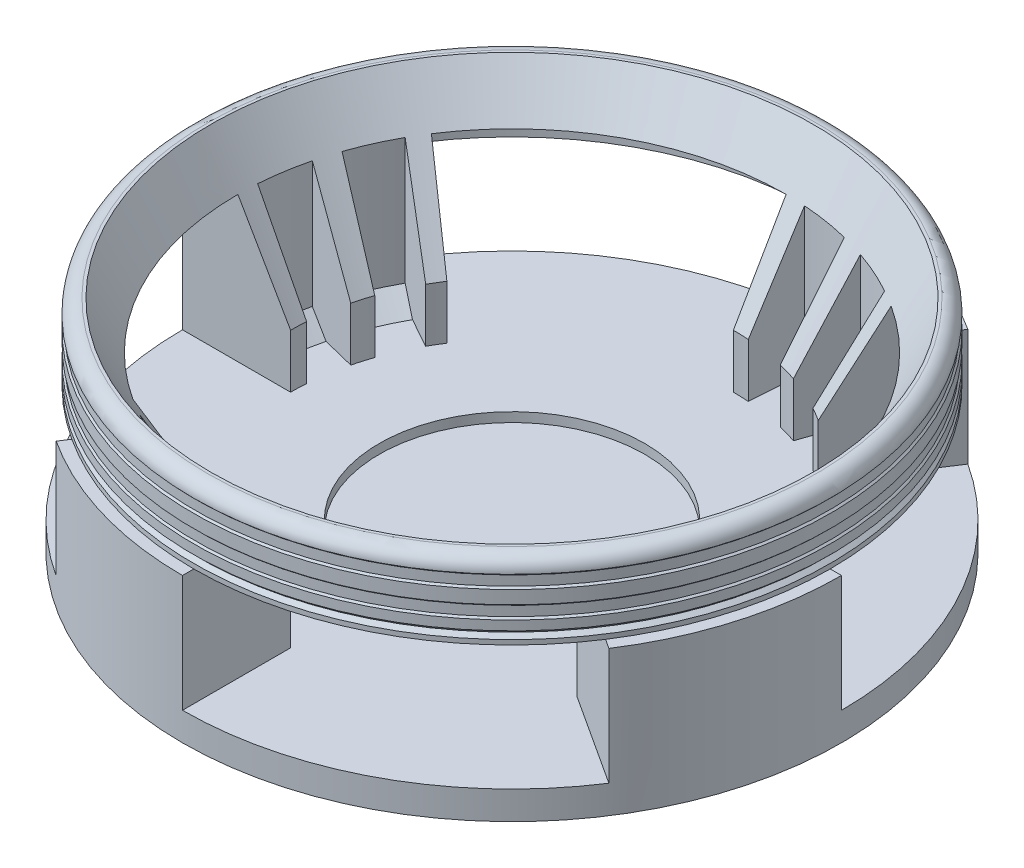
from build123d import *
from OCP.BRepFilletAPI import BRepFilletAPI_MakeChamfer
from build123d.topology import SkipClean

# Parameters (mm, degrees)
SKETCH_1_R          = 35
EXTRUDE_1_DEPTH     = 3
EXTRUDE_2_DEPTH     = 20.4
SKETCH_3_R          = 14.1
CUT_EXTRUDE_1_DEPTH = 1
CUT_EXTRUDE_START   = -8
SKETCH_4_R          = 35
SKETCH_4_R_2        = 33.8
CUT_EXTRUDE_2_DEPTH = 8
FILLET_1_R          = 1.5
CHAMFER_1_SIZE      = 11.777945491
CHAMFER_1_SIZE_2    = 20.4
CUT_EXTRUDE_3_DEPTH = 20.4
SKETCH_7_R          = 23.513248654
CUT_EXTRUDE_4_DEPTH = 20.4
CHAMFER_2_SIZE      = 2


with BuildPart() as part:
    # 草图1 → 凸台-拉伸1 (new body)
    with BuildSketch(Plane(origin=(0, 0, 0), x_dir=(1, 0, 0), z_dir=(0, 1, 0))):
        with Locations(Location((0, 0, 0), (0, 0, 270))):
            Circle(SKETCH_1_R)
    extrude(amount=EXTRUDE_1_DEPTH)

    # 草图2 → 凸台-拉伸2 (add)
    with SkipClean():  # the faces are left unmerged after this step: merging them gives an invalid solid
        with BuildSketch(Plane(origin=(0, 3, 0), x_dir=(1, 0, 0), z_dir=(0, 1, 0))):
            with BuildLine():
                Line((0, 35), (0, 32))
                ThreePointArc((0, 32), (9.088491031, 30.682231516), (17.42844912, 26.837458174))
                Line((17.42844912, 26.837458174), (19.062366226, 29.353469878))
                ThreePointArc((19.062366226, 29.353469878), (9.940537065, 33.55869072), (0, 35))
            make_face()
            with BuildLine():
                ThreePointArc((-32, 0), (-30.682231516, 9.088491031), (-26.837458174, 17.42844912))
                Line((-26.837458174, 17.42844912), (-29.353469878, 19.062366226))
                ThreePointArc((-29.353469878, 19.062366226), (-33.55869072, 9.940537065), (-35, 0))
                Line((-35, 0), (-32, 0))
            make_face()
            with BuildLine():
                Line((35, 0), (32, 0))
                ThreePointArc((32, 0), (30.682231516, -9.088491031), (26.837458174, -17.42844912))
                Line((26.837458174, -17.42844912), (29.353469878, -19.062366226))
                ThreePointArc((29.353469878, -19.062366226), (33.55869072, -9.940537065), (35, 0))
            make_face()
            with BuildLine():
                ThreePointArc((0, -32), (-9.088491031, -30.682231516), (-17.42844912, -26.837458174))
                Line((-17.42844912, -26.837458174), (-19.062366226, -29.353469878))
                ThreePointArc((-19.062366226, -29.353469878), (-9.940537065, -33.55869072), (0, -35))
                Line((0, -35), (0, -32))
            make_face()
        extrude(amount=EXTRUDE_2_DEPTH)

    # 草图3 → 切除-拉伸1 (cut)
    with SkipClean():  # the faces are left unmerged after this step: merging them gives an invalid solid
        with BuildSketch(Plane(origin=(0, 3, 0), x_dir=(1, 0, 0), z_dir=(0, 1, 0))):
            with Locations(Location((0, 0, 0), (0, 0, 270))):
                Circle(SKETCH_3_R)
        extrude(amount=-CUT_EXTRUDE_1_DEPTH, mode=Mode.SUBTRACT)

    # 草图4 → 切除-拉伸2 (cut)
    with SkipClean():  # the faces are left unmerged after this step: merging them gives an invalid solid
        with BuildSketch(Plane(origin=(0, 23.4, 0), x_dir=(1, 0, 0), z_dir=(0, 1, 0)).offset(CUT_EXTRUDE_START)):
            with Locations(Location((0, 0, 0), (0, 0, 270))):
                Circle(SKETCH_4_R)
            Circle(SKETCH_4_R_2, mode=Mode.SUBTRACT)
        extrude(amount=CUT_EXTRUDE_2_DEPTH, mode=Mode.SUBTRACT)

    # 圆角1
    fillet_1_edges = [part.edges().sort_by_distance(p)[0] for p in [
        (32.408107039, 23.4, 9.599718651),
        (9.599718651, 23.4, -32.408107039),
        (-32.408107039, 23.4, -9.599718651),
        (-9.599718651, 23.4, 32.408107039),
    ]]
    fillet(fillet_1_edges, radius=FILLET_1_R)

    # 倒角1
    chamfer_1_edges_1 = [part.edges().sort_by_distance(p)[0] for p in [
        (30.682231516, 3, 9.088491031),
    ]]
    chamfer_1_side_1 = [part.faces().sort_by_distance(p)[0] for p in [
        (30.456372984, 3, 9.021588686),
    ]]
    chamfer_1_edges_2 = [part.edges().sort_by_distance(p)[0] for p in [
        (9.088491031, 3, -30.682231516),
    ]]
    chamfer_1_side_2 = [part.faces().sort_by_distance(p)[0] for p in [
        (9.021588686, 3, -30.456372984),
    ]]
    chamfer_1_edges_3 = [part.edges().sort_by_distance(p)[0] for p in [
        (-30.682231516, 3, -9.088491031),
    ]]
    chamfer_1_side_3 = [part.faces().sort_by_distance(p)[0] for p in [
        (-30.456372984, 3, -9.021588686),
    ]]
    chamfer_1_edges_4 = [part.edges().sort_by_distance(p)[0] for p in [
        (-9.088491031, 3, 30.682231516),
    ]]
    chamfer_1_side_4 = [part.faces().sort_by_distance(p)[0] for p in [
        (-9.088491031, 3.23555891, 30.682231516),
    ]]
    chamfer_1 = BRepFilletAPI_MakeChamfer(part.part.solid().wrapped)
    for e in chamfer_1_edges_1:
        chamfer_1.Add(CHAMFER_1_SIZE - 0.0001, CHAMFER_1_SIZE_2 - 0.0001, e.wrapped, chamfer_1_side_1[0].wrapped)
    for e in chamfer_1_edges_2:
        chamfer_1.Add(CHAMFER_1_SIZE - 0.0001, CHAMFER_1_SIZE_2 - 0.0001, e.wrapped, chamfer_1_side_2[0].wrapped)
    for e in chamfer_1_edges_3:
        chamfer_1.Add(CHAMFER_1_SIZE - 0.0001, CHAMFER_1_SIZE_2 - 0.0001, e.wrapped, chamfer_1_side_3[0].wrapped)
    for e in chamfer_1_edges_4:
        chamfer_1.Add(CHAMFER_1_SIZE_2 - 0.0001, CHAMFER_1_SIZE - 0.0001, e.wrapped, chamfer_1_side_4[0].wrapped)
    add(Compound.cast(chamfer_1.Shape()), mode=Mode.REPLACE)  # a hair under: the kernel refuses the full size

    # 草图10 → 旋转2 (revolve)
    with BuildSketch(Plane(origin=(0, 0, 0), x_dir=(0.5446390350150274, 0, -0.8386705679454238), z_dir=(0.8386705679454238, 0, 0.5446390350150274)), mode=Mode.PRIVATE) as revolve_2_sk:
        with BuildLine():
            Line((32, 23.4), (29.113248654, 18.4))
            Line((29.113248654, 18.4), (30.267949192, 18.4))
            Line((30.267949192, 18.4), (31.373223106, 20.314390574))
            ThreePointArc((31.373223106, 20.314390574), (31.931886371, 20.545796475), (32.3, 20.066061454))
            Line((32.3, 20.066061454), (32.3, 15.4))
            Line((32.3, 15.4), (33.8, 15.4))
            Line((33.8, 15.4), (33.8, 21.9))
            ThreePointArc((33.8, 21.9), (33.360660172, 22.960660172), (32.3, 23.4))
            Line((32.3, 23.4), (32, 23.4))
        make_face()
    revolve(revolve_2_sk.sketch.rotate(Axis((0, 0, 0), (0, 1, 0)), 213), axis=Axis((0, 0, 0), (0, 1, 0)))

    # 草图6 → 切除-拉伸3 (cut)
    with BuildSketch(Plane(origin=(0, 23.4, 0), x_dir=(1, 0, 0), z_dir=(0, 1, 0))):
        with BuildLine():
            ThreePointArc((-20.1727946, 1.410619214), (-19.973087461, 3.163426279), (-19.621373066, 4.89215776))
            Line((-19.621373066, 4.89215776), (-28.248460747, 7.043132301))
            ThreePointArc((-28.248460747, 7.043132301), (-28.754816252, 4.554315479), (-29.042330244, 2.030837565))
            Line((-29.042330244, 2.030837565), (-20.1727946, 1.410619214))
        make_face()
        with BuildLine():
            ThreePointArc((-19.120328175, 6.583656966), (-18.47376604, 8.225050567), (-17.686607392, 9.803846567))
            Line((-17.686607392, 9.803846567), (-25.463021012, 14.114383024))
            ThreePointArc((-25.463021012, 14.114383024), (-26.596276065, 11.841425027), (-27.527117398, 9.478346635))
            Line((-27.527117398, 9.478346635), (-19.120328175, 6.583656966))
        make_face()
        with BuildLine():
            ThreePointArc((-6.583656966, -19.120328175), (-8.225050567, -18.47376604), (-9.803846567, -17.686607392))
            Line((-9.803846567, -17.686607392), (-14.114383024, -25.463021012))
            ThreePointArc((-14.114383024, -25.463021012), (-11.841425027, -26.596276065), (-9.478346635, -27.527117398))
            Line((-9.478346635, -27.527117398), (-6.583656966, -19.120328175))
        make_face()
        with BuildLine():
            ThreePointArc((-1.410619214, -20.1727946), (-3.163426279, -19.973087461), (-4.89215776, -19.621373066))
            Line((-4.89215776, -19.621373066), (-7.043132301, -28.248460747))
            ThreePointArc((-7.043132301, -28.248460747), (-4.554315479, -28.754816252), (-2.030837565, -29.042330244))
            Line((-2.030837565, -29.042330244), (-1.410619214, -20.1727946))
        make_face()
        with BuildLine():
            Line((27.527117398, -9.478346635), (19.120328175, -6.583656966))
            ThreePointArc((19.120328175, -6.583656966), (18.47376604, -8.225050567), (17.686607392, -9.803846567))
            Line((17.686607392, -9.803846567), (25.463021012, -14.114383024))
            ThreePointArc((25.463021012, -14.114383024), (26.596276065, -11.841425027), (27.527117398, -9.478346635))
        make_face()
        with BuildLine():
            Line((29.042330244, -2.030837565), (20.1727946, -1.410619214))
            ThreePointArc((20.1727946, -1.410619214), (19.973087461, -3.163426279), (19.621373066, -4.89215776))
            Line((19.621373066, -4.89215776), (28.248460747, -7.043132301))
            ThreePointArc((28.248460747, -7.043132301), (28.754816252, -4.554315479), (29.042330244, -2.030837565))
        make_face()
        with BuildLine():
            Line((9.478346635, 27.527117398), (6.583656966, 19.120328175))
            ThreePointArc((6.583656966, 19.120328175), (8.225050567, 18.47376604), (9.803846567, 17.686607392))
            Line((9.803846567, 17.686607392), (14.114383024, 25.463021012))
            ThreePointArc((14.114383024, 25.463021012), (11.841425027, 26.596276065), (9.478346635, 27.527117398))
        make_face()
        with BuildLine():
            Line((2.030837565, 29.042330244), (1.410619214, 20.1727946))
            ThreePointArc((1.410619214, 20.1727946), (3.163426279, 19.973087461), (4.89215776, 19.621373066))
            Line((4.89215776, 19.621373066), (7.043132301, 28.248460747))
            ThreePointArc((7.043132301, 28.248460747), (4.554315479, 28.754816252), (2.030837565, 29.042330244))
        make_face()
    extrude(amount=-CUT_EXTRUDE_3_DEPTH, mode=Mode.SUBTRACT)

    # 草图7 → 切除-拉伸4 (cut)
    with BuildSketch(Plane(origin=(0, 23.4, 0), x_dir=(1, 0, 0), z_dir=(0, 1, 0))):
        Circle(SKETCH_7_R)
    extrude(amount=-CUT_EXTRUDE_4_DEPTH, mode=Mode.SUBTRACT)

    # 倒角2
    chamfer_2_edges = [part.edges().sort_by_distance(p)[0] for p in [
        (26.596276065, 3, 11.841425027),
        (-4.554315479, 3, 28.754816252),
        (-11.841425027, 3, 26.596276065),
        (-26.596276065, 3, -11.841425027),
        (4.554315479, 3, -28.754816252),
        (11.841425027, 3, -26.596276065),
        (28.754816252, 3, 4.554315479),
        (-28.754816252, 3, -4.554315479),
    ]]
    chamfer(chamfer_2_edges, length=CHAMFER_2_SIZE)

    # 草图11 → 切除-旋转1 (revolve, cut)
    with BuildSketch(Plane(origin=(0, 0, 0), x_dir=(-0.8386705679454236, 0, -0.5446390350150278), z_dir=(0.5446390350150278, 0, -0.8386705679454236)), mode=Mode.PRIVATE) as cut_revolve_1_sk:
        Polygon((33.8, 21.9), (33.62, 21.72), (33.62, 20.68), (33.8, 20.5), align=None)
        Polygon((33.8, 19.1), (33.62, 18.92), (33.62, 17.88), (33.8, 17.7), align=None)
        Polygon((33.8, 16.7), (33.4, 16.3), (33.8, 15.9), align=None)
    revolve(cut_revolve_1_sk.sketch.rotate(Axis((0, 0, 0), (0, 1, 0)), 303), axis=Axis((0, 0, 0), (0, 1, 0)), mode=Mode.SUBTRACT)


solid = part.part
